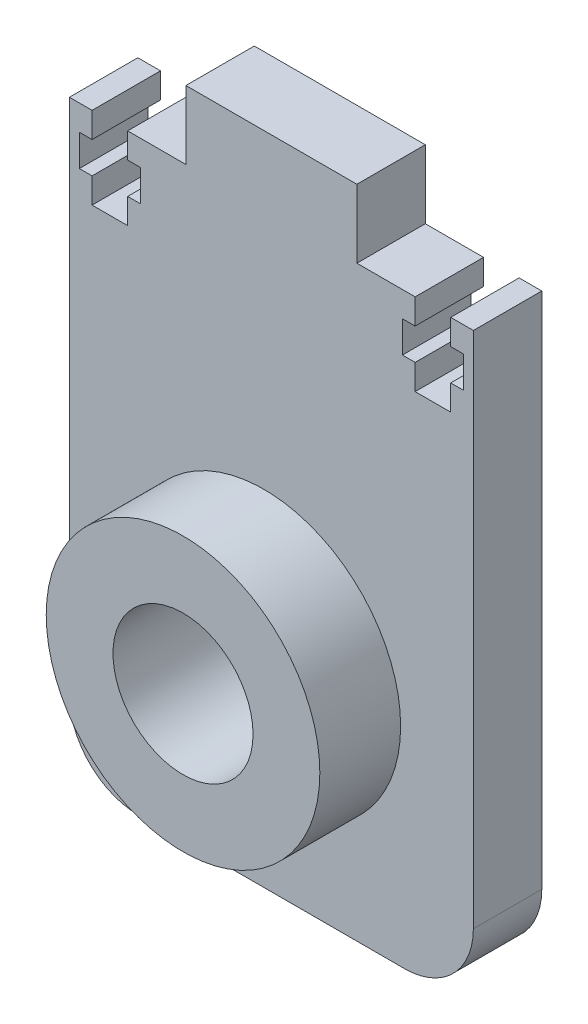
from build123d import *

# Parameters (mm, degrees)
SKETCH12_W           = 75
SKETCH12_H           = 121.71
BOSS_EXTRUDE10_DEPTH = 12.7
SKETCH15_R           = 25.4
BOSS_EXTRUDE11_DEPTH = 15
SKETCH23_R           = 13
CUT_EXTRUDE7_DEPTH   = 186.429535576
FILLET2_R            = 12.8
SKETCH25_W           = 21.625
SKETCH25_H           = 12.7
CUT_EXTRUDE9_DEPTH   = 184.961470596
CUT_EXTRUDE10_DEPTH  = 184.961470596


with BuildPart() as part:
    # Sketch12 → Boss-Extrude10 (new body)
    with BuildSketch(Plane.XY):
        with Locations((99.625849364, 60.855)):
            Rectangle(SKETCH12_W, SKETCH12_H)
    extrude(amount=BOSS_EXTRUDE10_DEPTH)

    # Sketch15 → Boss-Extrude11 (add)
    with BuildSketch(Plane.XY.offset(12.7)):
        with Locations((98.219620603, 38.627603634)):
            Circle(SKETCH15_R)
    extrude(amount=BOSS_EXTRUDE11_DEPTH)

    # Sketch23 → Cut-Extrude7 (cut, through all)
    with BuildSketch(Plane.XY.offset(27.7)):
        with Locations((98.219620603, 38.627603634)):
            Circle(SKETCH23_R)
    extrude(amount=-CUT_EXTRUDE7_DEPTH, mode=Mode.SUBTRACT)

    # Fillet2
    fillet2_edges = [part.edges().sort_by_distance(p)[0] for p in [
        (137.125849364, 0, 6.35),
        (62.125849364, 0, 6.35),
    ]]
    fillet(fillet2_edges, radius=FILLET2_R)

    # Sketch25 → Cut-Extrude9 (cut, through all)
    with BuildSketch(Plane.XY.offset(12.7)):
        with Locations((126.313349364, 115.36)):
            Rectangle(SKETCH25_W, SKETCH25_H)
        with Locations((72.938349364, 115.36)):
            Rectangle(SKETCH25_W, SKETCH25_H)
    extrude(amount=-CUT_EXTRUDE9_DEPTH, mode=Mode.SUBTRACT)

    # Sketch27 → Cut-Extrude10 (cut, through all)
    with BuildSketch(Plane.XY.offset(12.7)):
        Polygon((132.917349364, 109.01), (132.917349364, 104.311), (135.279349364, 104.311), (135.279349364, 98.469), (132.917349364, 98.469), (132.917349364, 93.77), (126.313349364, 93.77), (126.313349364, 98.469), (123.951349364, 98.469), (123.951349364, 104.311), (126.313349364, 104.311), (126.313349364, 109.01), align=None)
        Polygon((72.938349364, 98.469), (75.300349364, 98.469), (75.300349364, 104.311), (72.938349364, 104.311), (72.938349364, 109.01), (66.334349364, 109.01), (66.334349364, 104.311), (63.972349364, 104.311), (63.972349364, 98.469), (66.334349364, 98.469), (66.334349364, 93.77), (72.938349364, 93.77), align=None)
    extrude(amount=-CUT_EXTRUDE10_DEPTH, mode=Mode.SUBTRACT)


solid = part.part
